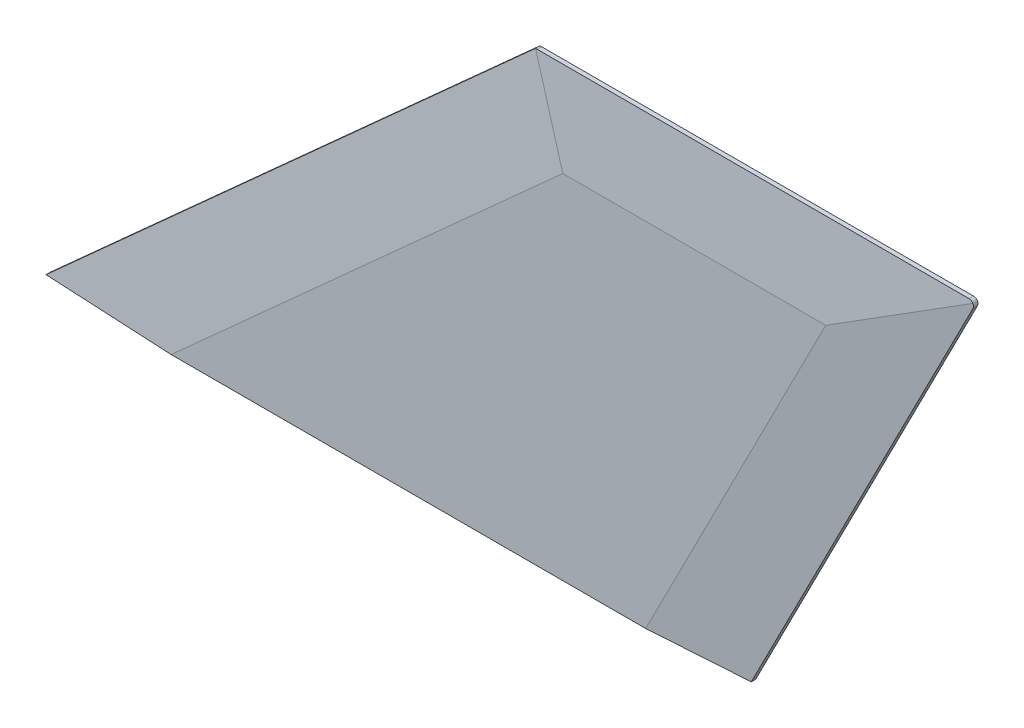
from build123d import *
from OCP.BRepFilletAPI import BRepFilletAPI_MakeChamfer

# Parameters (mm, degrees)
BOSS_EXTRUDE1_DEPTH = 1
CHAMFER1_SIZE       = 0.75
CHAMFER1_SIZE2      = 10
FILLET1_R           = 0.5


# Read off the part's stored shape, not the designer's step: Mirror1
with BuildPart() as part:
    # Sketch1 → Boss-Extrude1 (new, symmetric)
    with BuildSketch(Plane.XY):
        Polygon((0, 0), (80, 0), (105.530625741, 50), (55.530625741, 50), align=None)
    extrude(amount=BOSS_EXTRUDE1_DEPTH, both=True)

    # Chamfer1: one chamfer whose edges measure the first distance from different faces: ONE call of the kernel's chamfer builder (chamfer() names one face for all edges)
    chamfer1_edges_1 = [part.edges().sort_by_distance(p)[0] for p in [
        (92.765312871, 25, 1),
    ]]
    chamfer1_side_1 = [part.faces().sort_by_distance(p)[0] for p in [
        (92.765312871, 25, 0),
    ]]
    chamfer1_edges_2 = [part.edges().sort_by_distance(p)[0] for p in [
        (80.530625741, 50, 1),
    ]]
    chamfer1_side_2 = [part.faces().sort_by_distance(p)[0] for p in [
        (80.530625741, 50, 0),
    ]]
    chamfer1_edges_3 = [part.edges().sort_by_distance(p)[0] for p in [
        (27.765312871, 25, 1),
    ]]
    chamfer1_side_3 = [part.faces().sort_by_distance(p)[0] for p in [
        (27.765312871, 25, 0),
    ]]
    chamfer1 = BRepFilletAPI_MakeChamfer(part.part.solid().wrapped)
    for e in chamfer1_edges_1:
        chamfer1.Add(CHAMFER1_SIZE, CHAMFER1_SIZE2, e.wrapped, chamfer1_side_1[0].wrapped)  # the first distance lies on this face
    for e in chamfer1_edges_2:
        chamfer1.Add(CHAMFER1_SIZE, CHAMFER1_SIZE2, e.wrapped, chamfer1_side_2[0].wrapped)  # the first distance lies on this face
    for e in chamfer1_edges_3:
        chamfer1.Add(CHAMFER1_SIZE, CHAMFER1_SIZE2, e.wrapped, chamfer1_side_3[0].wrapped)  # the first distance lies on this face
    add(Compound.cast(chamfer1.Shape()), mode=Mode.REPLACE)

    # Mirror1
    split(bisect_by=Plane.XY, keep=Keep.TOP)

    # Mirror1 2: part across plane


with BuildPart() as part_1:
    add(part.part)
    add(part.part.mirror(Plane.XY))

    # Fillet1
    fillet1_edges = [part_1.edges().sort_by_distance(p)[0] for p in [
        (55.530625741, 50, 0),
        (105.530625741, 50, 0),
    ]]
    fillet(fillet1_edges, radius=FILLET1_R)


solid = part_1.part
